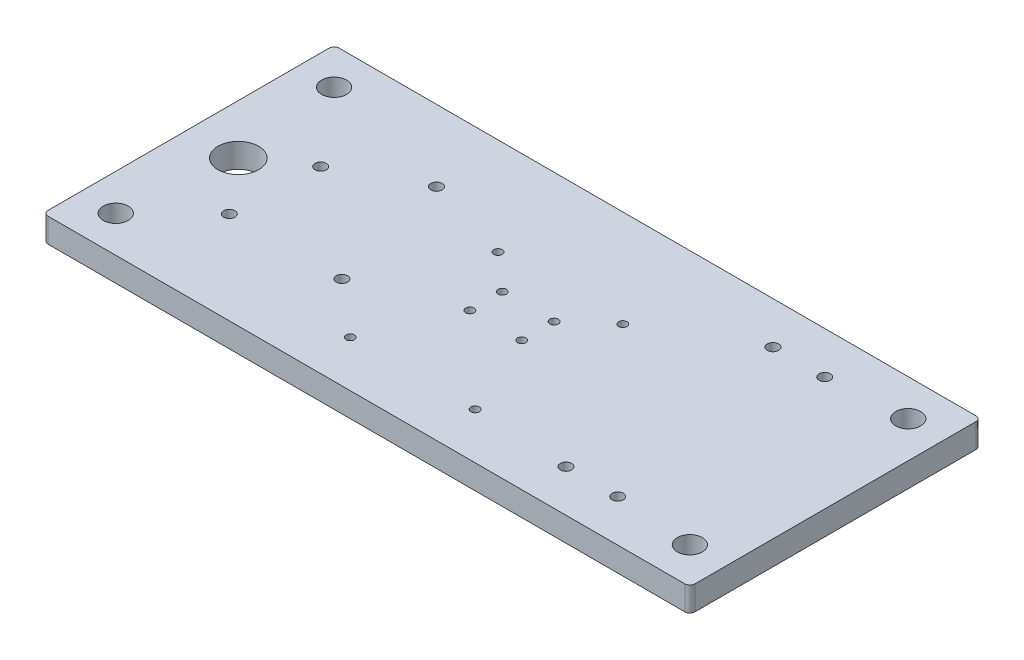
from build123d import *

# Parameters (mm, degrees)
SKETCH1_W                      = 254
SKETCH1_H                      = 114.3
BOSS_EXTRUDE1_DEPTH            = 9.525
F_3_8_CLEARANCE_HOLE1_D        = 9.8044
F_3_8_CLEARANCE_HOLE1_DEPTH    = 10
F_3_8_CLEARANCE_HOLE1_TIP      = 2.945538927
M2_5_CLEARANCE_HOLE3_D         = 3.3
M2_5_CLEARANCE_HOLE3_DEPTH     = 10
M2_5_CLEARANCE_HOLE3_TIP       = 0.991420021
FILLET1_R                      = 2
M3_CLEARANCE_HOLE4_D           = 4.45
M3_CLEARANCE_HOLE4_DEPTH       = 10
M3_CLEARANCE_HOLE4_TIP         = 1.336914877
SKETCH22_R                     = 8
CUT_EXTRUDE1_DEPTH             = 140.5917194
M3_CLEARANCE_HOLE5_D           = 4.45
M3_CLEARANCE_HOLE5_DEPTH       = 10
M3_CLEARANCE_HOLE5_TIP         = 1.336914877
M2_5_CLEARANCE_HOLE4_OUTLINE_R = 1.65
M2_5_CLEARANCE_HOLE4_DEPTH     = 9.525


# Read off the part's stored shape, not the designer's step: M2.5 Clearance Hole4
with BuildPart() as part:
    # Sketch1 → Boss-Extrude1 (new body)
    with BuildSketch(Plane(origin=(0, 0, 0), x_dir=(1, 0, 0), z_dir=(0, 1, 0))):
        Rectangle(SKETCH1_W, SKETCH1_H)
    extrude(amount=BOSS_EXTRUDE1_DEPTH)

    # 3/8 Clearance Hole1
    with Locations(Plane(origin=(0, 9.525, 0), x_dir=(1, 0, 0), z_dir=(0, 1, 0))):
        with Locations((112.7125, 42.8625), (112.7125, -42.8675), (-112.7175, 42.8625), (-112.7175, -42.8675)):
            Hole(F_3_8_CLEARANCE_HOLE1_D / 2, depth=F_3_8_CLEARANCE_HOLE1_DEPTH)
            with Locations((0, 0, -(F_3_8_CLEARANCE_HOLE1_DEPTH + F_3_8_CLEARANCE_HOLE1_TIP / 2))):  # 118° drill point
                Cone(0, F_3_8_CLEARANCE_HOLE1_D / 2, F_3_8_CLEARANCE_HOLE1_TIP, mode=Mode.SUBTRACT)

    # M2.5 Clearance Hole3
    with Locations(Plane(origin=(0, 9.525, 0), x_dir=(1, 0, 0), z_dir=(0, 1, 0))):
        with Locations((24.5, 19), (-24.5, -39), (24.5, -39), (-24.5, 19)):
            Hole(M2_5_CLEARANCE_HOLE3_D / 2, depth=M2_5_CLEARANCE_HOLE3_DEPTH)
            with Locations((0, 0, -(M2_5_CLEARANCE_HOLE3_DEPTH + M2_5_CLEARANCE_HOLE3_TIP / 2))):  # 118° drill point
                Cone(0, M2_5_CLEARANCE_HOLE3_D / 2, M2_5_CLEARANCE_HOLE3_TIP, mode=Mode.SUBTRACT)

    # Fillet1
    fillet1_edges = [part.edges().sort_by_distance(p)[0] for p in [
        (127, 4.7625, 57.15),
        (-127, 4.7625, 57.15),
        (-127, 4.7625, -57.15),
        (127, 4.7625, -57.15),
    ]]
    fillet(fillet1_edges, radius=FILLET1_R)

    # M3 Clearance Hole4
    with Locations(Plane(origin=(0, 9.525, 0), x_dir=(1, 0, 0), z_dir=(0, 1, 0))):
        with Locations((-58.8, 29.15), (-46, -20.8), (-90.2, -20.8), (-88.35, 13.25)):
            Hole(M3_CLEARANCE_HOLE4_D / 2, depth=M3_CLEARANCE_HOLE4_DEPTH)
            with Locations((0, 0, -(M3_CLEARANCE_HOLE4_DEPTH + M3_CLEARANCE_HOLE4_TIP / 2))):  # 118° drill point
                Cone(0, M3_CLEARANCE_HOLE4_D / 2, M3_CLEARANCE_HOLE4_TIP, mode=Mode.SUBTRACT)

    # Sketch22 → Cut-Extrude1 (cut, through all)
    with BuildSketch(Plane(origin=(0, 9.525, 0), x_dir=(1, 0, 0), z_dir=(0, 1, 0))):
        with Locations(Location((-107.475, 0, 0), (0, 0, 270))):
            Circle(SKETCH22_R)
    extrude(amount=-CUT_EXTRUDE1_DEPTH, mode=Mode.SUBTRACT)

    # M3 Clearance Hole5
    with Locations(Plane(origin=(0, 9.525, 0), x_dir=(1, 0, 0), z_dir=(0, 1, 0))):
        with Locations((61.84, 40.64), (61.84, -40.64), (82.16, -40.64), (82.16, 40.64)):
            Hole(M3_CLEARANCE_HOLE5_D / 2, depth=M3_CLEARANCE_HOLE5_DEPTH)
            with Locations((0, 0, -(M3_CLEARANCE_HOLE5_DEPTH + M3_CLEARANCE_HOLE5_TIP / 2))):  # 118° drill point
                Cone(0, M3_CLEARANCE_HOLE5_D / 2, M3_CLEARANCE_HOLE5_TIP, mode=Mode.SUBTRACT)

    # M2.5 Clearance Hole4 outline → M2.5 Clearance Hole4 (cut)
    with BuildSketch(Plane(origin=(0, 0, 0), x_dir=(1, 0, 0), z_dir=(0, 1, 0))):
        with Locations((-10.16, 6.35)):
            Circle(M2_5_CLEARANCE_HOLE4_OUTLINE_R)
        with Locations((10.16, 6.35)):
            Circle(M2_5_CLEARANCE_HOLE4_OUTLINE_R)
        with Locations((10.16, -6.35)):
            Circle(M2_5_CLEARANCE_HOLE4_OUTLINE_R)
        with Locations((-10.16, -6.35)):
            Circle(M2_5_CLEARANCE_HOLE4_OUTLINE_R)
    extrude(amount=M2_5_CLEARANCE_HOLE4_DEPTH, mode=Mode.SUBTRACT)


solid = part.part
